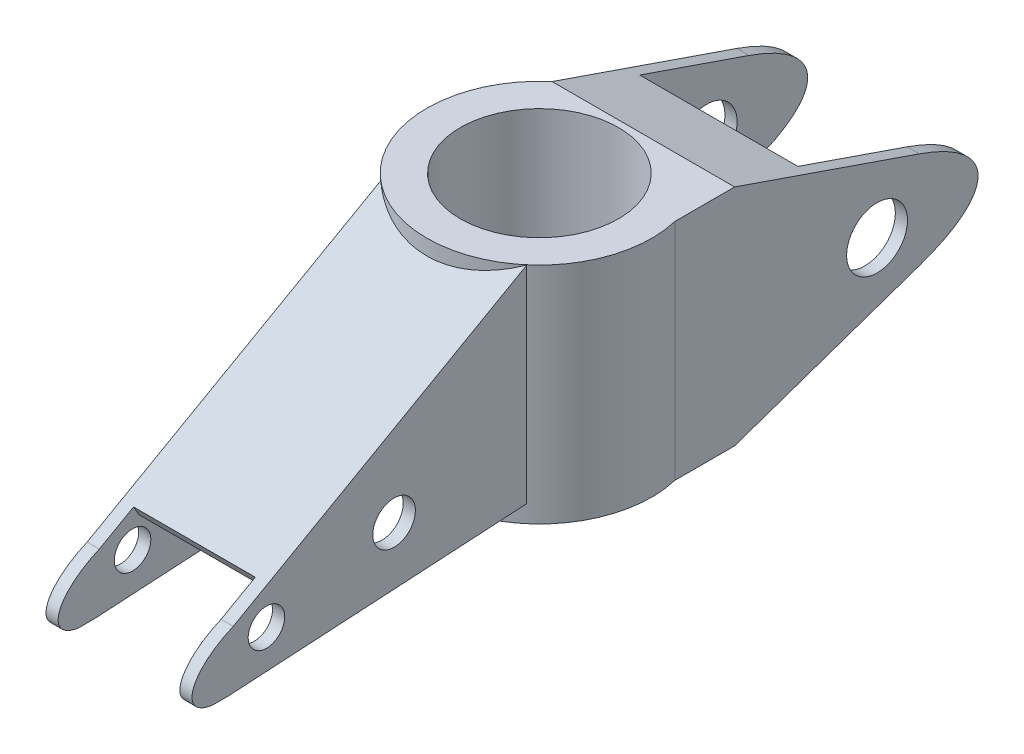
from build123d import *

# Parameters (mm, degrees)
SKETCH3_W                = 4
SKETCH3_H                = 73.62
BOSS_EXTRUDE2_DEPTH      = 110
BOSS_EXTRUDE2_2_DEPTH    = 110
SKETCH4_OUTSIDE_W        = 140.16
SKETCH4_OUTSIDE_H        = 103.78
CUT_EXTRUDE1_DEPTH       = 110
BOSS_EXTRUDE3_DEPTH      = 40
SKETCH6_R                = 7
SKETCH6_R_2              = 6
CUT_EXTRUDE2_DEPTH       = 110
SKETCH7_R                = 37
SKETCH7_R_2              = 26
BOSS_EXTRUDE4_DEPTH      = 73.7
BOSS_EXTRUDE6_START      = -73.7
BOSS_EXTRUDE6_DEPTH      = 73.7
CUT_EXTRUDE9_START       = -60
CUT_EXTRUDE9_DEPTH       = 60
SKETCH15_R               = 10
CUT_EXTRUDE11_DEPTH      = 74
BOSS_EXTRUDE8_REACH      = 171.943
CUT_EXTRUDE12_DEPTH      = 172.60636515
CUT_EXTRUDE12_DEPTH_BACK = 172.60636515
SKETCH18_W               = 0.383748065
SKETCH18_H               = 73.7
BOSS_EXTRUDE9_START      = -5
BOSS_EXTRUDE9_DEPTH      = 5
CUT_EXTRUDE13_DEPTH      = 50


# Read off the part's stored shape, not the designer's step: Cut-Extrude9
with BuildPart() as part:
    # Sketch3 → Boss-Extrude2 (new body)
    with BuildSketch(Plane.XY):
        with Locations((2, 36.81)):
            Rectangle(SKETCH3_W, SKETCH3_H)
    extrude(amount=BOSS_EXTRUDE2_DEPTH)


with BuildPart() as body_2:
    # Sketch3 → Boss-Extrude2 2 (new body)
    with BuildSketch(Plane.XY):
        with Locations((46, 36.81)):
            Rectangle(SKETCH3_W, SKETCH3_H)
    extrude(amount=BOSS_EXTRUDE2_2_DEPTH)


with BuildPart() as cut_extrude1_tool:
    # Sketch4 outside → Cut-Extrude1 (new body)
    with BuildSketch(Plane(origin=(48, 0, 0), x_dir=(0, 0, -1), z_dir=(1, 0, 0))):
        with Locations((-55, 36.81)):
            Rectangle(SKETCH4_OUTSIDE_W, SKETCH4_OUTSIDE_H)
        with BuildLine():
            Line((0, 5.709271206), (-99.676636629, -0.093636173))
            add(Edge.make_bspline(
                [(-96.468976077, 19.025739265), (-149.450115124, -2.991315062), (-99.676636629, -0.093636173)],
                knots=[1.570796327, 1.570796327, 1.570796327, 4.103862701, 4.103862701, 4.103862701], degree=2, weights=[1, 0.299590242, 1]))
            Line((-96.468976077, 19.025739265), (0, 73.62))
            Line((0, 73.62), (0, 5.709271206))
        make_face(mode=Mode.SUBTRACT)
    extrude(amount=-CUT_EXTRUDE1_DEPTH)


with BuildPart() as part_1:
    add(part.part)

    # Cut-Extrude1: cut by cut_extrude1_tool
    add(cut_extrude1_tool.part, mode=Mode.SUBTRACT)



with BuildPart() as body_2_1:
    add(body_2.part)

    # Cut-Extrude1: cut by cut_extrude1_tool
    add(cut_extrude1_tool.part, mode=Mode.SUBTRACT)


with BuildPart() as part_2:
    add(part_1.part)

    add(body_2_1.part)  # Boss-Extrude3 merges body 2
    # Sketch5 → Boss-Extrude3 (add)
    with BuildSketch(Plane(origin=(4, 0, 0), x_dir=(0, 0, -1), z_dir=(1, 0, 0))):
        Polygon((0, 73.62), (-85.221110514, 25.391194049), (-83.506537519, 22.361514757), (0, 69.62), align=None)
    extrude(amount=BOSS_EXTRUDE3_DEPTH)

    # Sketch6 → Cut-Extrude2 (cut)
    with BuildSketch(Plane(origin=(48, 0, 0), x_dir=(0, 0, -1), z_dir=(1, 0, 0))):
        with Locations(Location((-43.596276135, 22.110704559, 0), (0, 0, 90))):
            Circle(SKETCH6_R)
        with Locations(Location((-85.5494254, 13.322513691, 0), (0, 0, 90))):
            Circle(SKETCH6_R_2)
    extrude(amount=-CUT_EXTRUDE2_DEPTH, mode=Mode.SUBTRACT)

    # Sketch7 → Boss-Extrude4 (add)
    with BuildSketch(Plane(origin=(0, 0, 0), x_dir=(1, 0, 0), z_dir=(0, 1, 0))):
        with Locations(Location((24, 28.160255681, 0), (0, 0, 270))):
            Circle(SKETCH7_R)
        with Locations(Location((24, 28.160255681, 0), (0, 0, 270))):
            Circle(SKETCH7_R_2, mode=Mode.SUBTRACT)
    extrude(amount=BOSS_EXTRUDE4_DEPTH)

    # Sketch9 → Boss-Extrude6 (add)
    with BuildSketch(Plane(origin=(0, 73.7, 0), x_dir=(1, 0, 0), z_dir=(0, 1, 0)).offset(BOSS_EXTRUDE6_START)):
        with BuildLine():
            ThreePointArc((56, 46.734431302), (58.367878709, 41.866054199), (60, 36.704259426))
            Line((60, 36.704259426), (60, 136.704259426))
            Line((60, 136.704259426), (56, 136.704259426))
            Line((56, 136.704259426), (56, 46.734431302))
        make_face()
        with BuildLine():
            Line((0, 136.320511361), (0, 56.320511361))
            ThreePointArc((0, 56.320511361), (1.949988398, 57.872155458), (4, 59.289020513))
            Line((4, 59.289020513), (4, 136.320511361))
            Line((4, 136.320511361), (0, 136.320511361))
        make_face()
    extrude(amount=BOSS_EXTRUDE6_DEPTH)

    # Cut-Extrude9 outline → Cut-Extrude9 (cut)
    with BuildSketch(Plane.ZY.offset(CUT_EXTRUDE9_START)):
        with BuildLine():
            add(Edge.make_bspline(
                [(-136.320511361, 36.85), (-136.320511361, 27.575850811), (-117.029991726, 20.926444667)],
                knots=[6.283185307, 6.283185307, 6.283185307, 7.054517173, 7.054517173, 7.054517173], degree=2, weights=[0.858491437, 0.858491437, 1]))
            Line((-136.320511361, 36.85), (-136.320511361, 0))
            Line((-136.320511361, 0), (-56.320511361, 0))
            Line((-56.320511361, 0), (-117.029991726, 20.926444667))
        make_face()
        with BuildLine():
            add(Edge.make_bspline(
                [(-117.029991726, 52.773555333), (-136.320511361, 46.124149189), (-136.320511361, 36.85)],
                knots=[5.511853442, 5.511853442, 5.511853442, 6.283185307, 6.283185307, 6.283185307], degree=2, weights=[1, 0.858491437, 0.858491437]))
            Line((-117.029991726, 52.773555333), (-56.320511361, 73.7))
            Line((-56.320511361, 73.7), (-136.320511361, 73.7))
            Line((-136.320511361, 73.7), (-136.320511361, 36.85))
        make_face()
    extrude(amount=CUT_EXTRUDE9_DEPTH, mode=Mode.SUBTRACT)

    # Sketch15 → Cut-Extrude11 (cut)
    with BuildSketch(Plane(origin=(60, 0, 0), x_dir=(0, 0, -1), z_dir=(1, 0, 0))):
        with Locations((103.144942626, 35.814780524)):
            Circle(SKETCH15_R)
    extrude(amount=-CUT_EXTRUDE11_DEPTH, mode=Mode.SUBTRACT)

    # Boss-Extrude8: up to this face of the body (flat: up to its plane)
    boss_extrude8_end = Plane(part_2.part.faces().sort_by_distance((4, 36.955026581, -88.076596364))[0])
    # Sketch16 → Boss-Extrude8 (add, up to the picked face)
    with BuildSketch(Plane.ZY.offset(-56), mode=Mode.PRIVATE) as boss_extrude8_sk1:
        Polygon((-58.244155034, 73.036923613), (-81.124851518, 65.149990205), (-79.821326308, 61.368347436), (-58.244155034, 68.805958136), align=None)
    boss_extrude8_tool1 = split(extrude(boss_extrude8_sk1.sketch, amount=BOSS_EXTRUDE8_REACH, mode=Mode.PRIVATE), bisect_by=boss_extrude8_end, keep=Keep.BOTH, mode=Mode.PRIVATE)
    add(boss_extrude8_tool1.solids().sort_by(Axis((56, 67.109883, -69.361807), (-1, 0, 0)))[0])

    # Sketch18 → Cut-Extrude12 (cut, two sides: drawn at the far end of the back side and taken through both)
    with BuildSketch(Plane(origin=(60, 0, 0), x_dir=(0, 0, -1), z_dir=(1, 0, 0)).offset(-CUT_EXTRUDE12_DEPTH_BACK)):
        with Locations((136.512385394, 36.85)):
            Rectangle(SKETCH18_W, SKETCH18_H)
    extrude(amount=CUT_EXTRUDE12_DEPTH + CUT_EXTRUDE12_DEPTH_BACK, mode=Mode.SUBTRACT)

    # Sketch19 → Boss-Extrude9 (add)
    with BuildSketch(Plane(origin=(0, 73.7, 0), x_dir=(1, 0, 0), z_dir=(0, 1, 0)).offset(BOSS_EXTRUDE9_START)):
        with BuildLine():
            Line((56, 56.320511361), (56, 58.244155034))
            Line((56, 58.244155034), (45.539707511, 58.244155034))
            ThreePointArc((45.539707511, 58.244155034), (46.79015887, 57.308302934), (48, 56.320511361))
            ThreePointArc((48, 56.320511361), (52.407274292, 51.867359411), (56, 46.734431302))
            Line((56, 46.734431302), (56, 56.320511361))
        make_face()
    extrude(amount=BOSS_EXTRUDE9_DEPTH)

    # Sketch20 → Cut-Extrude13 (cut)
    with BuildSketch(Plane(origin=(60, 0, 0), x_dir=(0, 0, -1), z_dir=(1, 0, 0))):
        Polygon((58.244155034, 73.036923613), (58.244155034, 73.7), (56.320511361, 73.7), align=None)
    extrude(amount=-CUT_EXTRUDE13_DEPTH, mode=Mode.SUBTRACT)


solid = part_2.part
